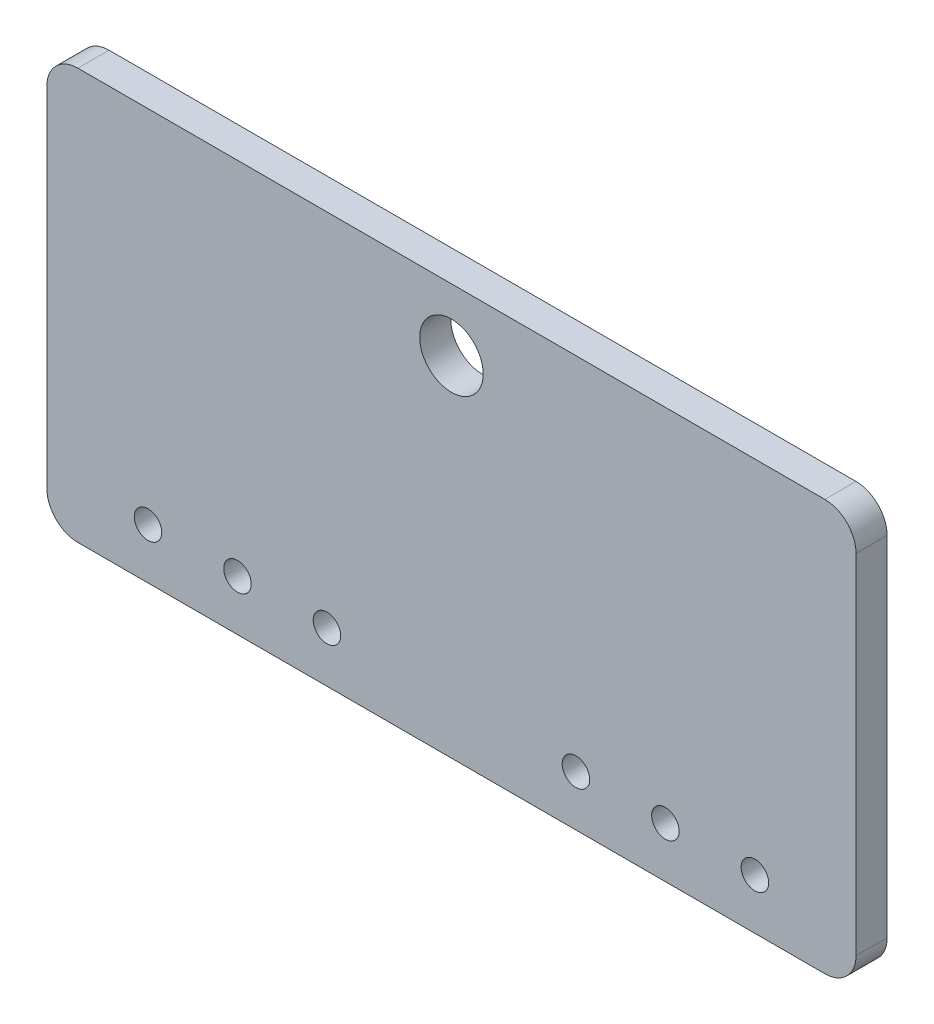
from build123d import *

# Parameters (mm, degrees)
SKETCH1_W              = 165.1
SKETCH1_H              = 83.82
BOSS_EXTRUDE1_DEPTH    = 6.35
F_10_CLEARANCE_HOLE1_D = 5.6134
FILLET1_R              = 6.35
SKETCH8_R              = 6.477
CUT_EXTRUDE1_DEPTH     = 186.267711434


with BuildPart() as part:
    # Sketch1 → Boss-Extrude1 (new body)
    with BuildSketch(Plane.XY):
        with Locations((82.55, 41.91)):
            Rectangle(SKETCH1_W, SKETCH1_H)
    extrude(amount=BOSS_EXTRUDE1_DEPTH)

    # #10 Clearance Hole1 (through all)
    with Locations(Plane.XY.offset(6.35)):
        with Locations((20.6375, 10.3124), (57.15, 10.3124), (107.95, 10.3124), (144.4625, 10.3124), (38.89375, 10.3124), (126.20625, 10.3124)):
            Hole(F_10_CLEARANCE_HOLE1_D / 2)

    # Fillet1
    fillet1_edges = [part.edges().sort_by_distance(p)[0] for p in [
        (165.1, 0, 3.175),
        (165.1, 83.82, 3.175),
        (0, 83.82, 3.175),
        (0, 0, 3.175),
    ]]
    fillet(fillet1_edges, radius=FILLET1_R)

    # Sketch8 → Cut-Extrude1 (cut, through all)
    with BuildSketch(Plane.XY.offset(6.35)):
        with Locations((82.55, 71.12)):
            Circle(SKETCH8_R)
    extrude(amount=-CUT_EXTRUDE1_DEPTH, mode=Mode.SUBTRACT)


solid = part.part
